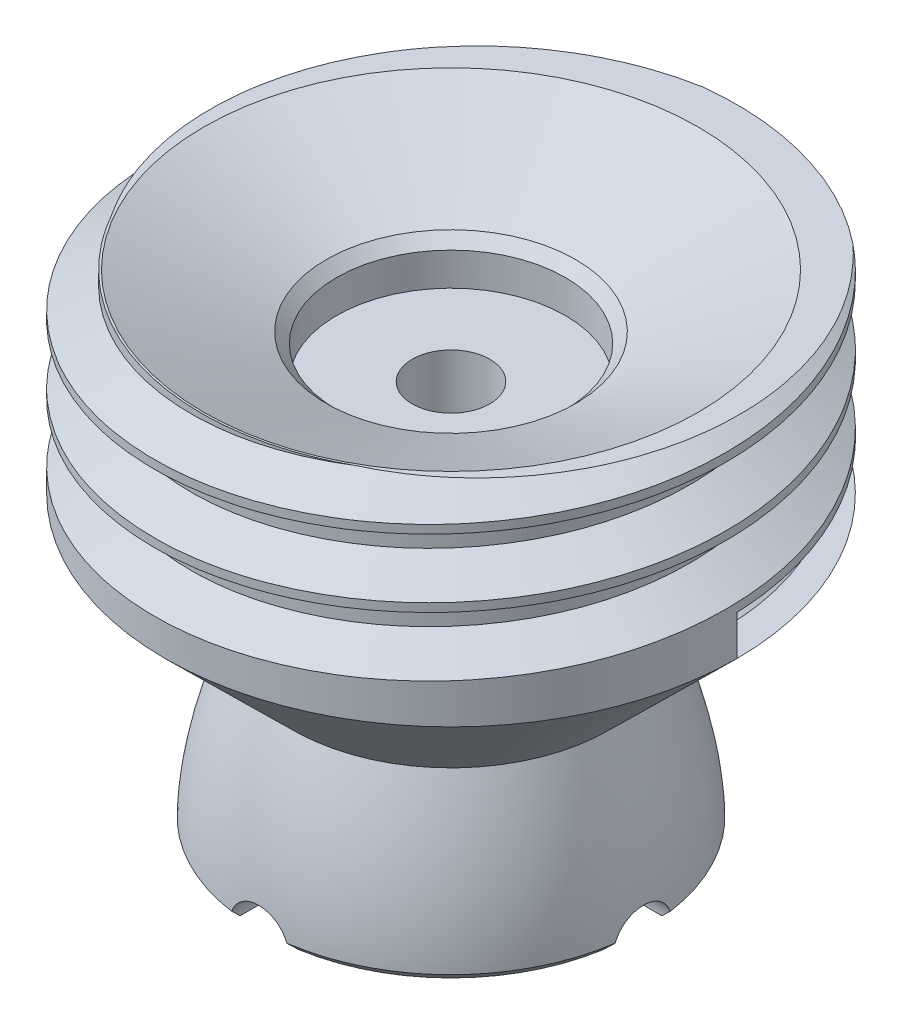
from build123d import *

# Parameters (mm, degrees)
SKETCH1_R           = 14.75
BOSS_EXTRUDE1_DEPTH = 10
CHAMFER1_SIZE       = 0.3
CHAMFER1_SIZE2      = 0.582711802
THREAD1_PITCH       = 3.5
SKETCH6_R           = 1.5
CUT_EXTRUDE1_DEPTH  = 10
CIRPATTERN1_COUNT   = 4
CHAMFER2_SIZE       = 0.5


with BuildPart() as part:
    # Sketch1 → Boss-Extrude1 (new body)
    with BuildSketch(Plane(origin=(0, 0, 0), x_dir=(1, 0, 0), z_dir=(0, 1, 0))):
        with Locations(Location((0, 0, 0), (0, 0, 270))):
            Circle(SKETCH1_R)
    extrude(amount=BOSS_EXTRUDE1_DEPTH)

    # Sketch2 → Cut-Revolve1 (revolve, cut)
    with BuildSketch(Plane.XY, mode=Mode.PRIVATE) as cut_revolve1_sk:
        Polygon((-12.75, 10), (-5.9, 7), (-5.9, 5), (-2, 5), (-2, 0), (0, 0), (0, 10), align=None)
    revolve(cut_revolve1_sk.sketch.rotate(Axis((0, 0, 0), (0, 1, 0)), 270), axis=Axis((0, 0, 0), (0, 1, 0)), mode=Mode.SUBTRACT)

    # Chamfer1
    chamfer1_edges = [part.edges().sort_by_distance(p)[0] for p in [
        (0, 7, 5.9),
    ]]
    chamfer1_side = [part.faces().sort_by_distance(p)[0] for p in [
        (0, 6, 5.9),
    ]]
    chamfer(chamfer1_edges, length=CHAMFER1_SIZE, length2=CHAMFER1_SIZE2, reference=chamfer1_side[0])

    # Sketch3 → Revolve1 (revolve)
    with BuildSketch(Plane.XY, mode=Mode.PRIVATE) as revolve1_sk:
        with BuildLine():
            Line((-2, 0), (-6, 0))
            add(Edge.make_bspline(
                [(-6, 0), (-6, -0.036632834), (-6.001984778, -0.099313082), (-6.019871164, -0.308851925), (-6.076981187, -0.662103545), (-6.213520901, -1.2239813), (-6.485193981, -2.118643776), (-6.976463935, -3.463152951), (-7.967633466, -5.967238423), (-9.06904132, -8.891885812), (-9.736354091, -11.793553851), (-9.957681049, -13.547919401), (-10, -14.471549721), (-10, -14.92820323)],
                knots=[0, 0, 0, 0, 0.03125, 0.0625, 0.125, 0.1875, 0.25, 0.375, 0.5, 0.75, 0.875, 0.9375, 1, 1, 1, 1], degree=3))
            Line((-10, -14.92820323), (-6, -14.92820323))
            add(Edge.make_bspline(
                [(-2, 0), (-2, -3.767042409), (-6, -9.452761511), (-6, -14.92820323)],
                knots=[0, 0, 0, 0, 1, 1, 1, 1], degree=3))
        make_face()
    revolve(revolve1_sk.sketch.rotate(Axis((0, 0, 0), (0, -1, 0)), 90), axis=Axis((0, 0, 0), (0, -1, 0)))

    # Thread1: arcs per turn and ends read off the stored shape
    # Thread1: the profile of Thread Profile1 profile screwed along a right-hand helix through 3.142858 turns, 12 arcs to a turn; built about Z, then put on its axis
    thread1_z = Axis((0, 0, 0), (0, 0, 1))
    thread1_corners = [(14.7503, 0, -0.000173205), (14.7503, 0, 3.062673196), (12.855569438, 0, 1.968749995), (12.855569438, 0, 1.093749995)]
    with BuildLine(mode=Mode.PRIVATE) as thread1_profile:
        Line(thread1_corners[0], thread1_corners[1])
        Line(thread1_corners[1], thread1_corners[2])
        Line(thread1_corners[2], thread1_corners[3])
        Line(thread1_corners[3], thread1_corners[0])
    thread1_cap = Face(thread1_profile.wire())
    thread1_turn_angles = [0, 15, 30, 45, 60, 75, 90, 105, 120, 135, 150, 165, 180, 195, 210, 225, 240, 255, 270, 285, 300, 315, 330, 345, 360]
    thread1_turn_weights = [1, 0.9659258262890683, 1, 0.9659258262890683, 1, 0.9659258262890683, 1, 0.9659258262890683, 1, 0.9659258262890683, 1, 0.9659258262890683, 1, 0.9659258262890683, 1, 0.9659258262890683, 1, 0.9659258262890683, 1, 0.9659258262890683, 1, 0.9659258262890683, 1, 0.9659258262890683, 1]
    thread1_turn_rails = [Edge.make_bspline([Vector(p[0], p[1], 0).rotate(thread1_z, thread1_turn_angles[k]) / thread1_turn_weights[k] + Vector(0, 0, p[2] + THREAD1_PITCH * thread1_turn_angles[k] / 360) for k in range(25)], [0, 0, 0, 1, 1, 2, 2, 3, 3, 4, 4, 5, 5, 6, 6, 7, 7, 8, 8, 9, 9, 10, 10, 11, 11, 12, 12, 12], 2, thread1_turn_weights) for p in thread1_corners]
    thread1_turn_sides = [Face.make_surface_from_curves(thread1_turn_rails[p[0]], thread1_turn_rails[p[1]]) for p in [(0, 1), (1, 2), (2, 3), (3, 0)]]
    thread1_last_angles = [1080, 1095, 1110, 1120.7145, 1131.429]
    thread1_last_weights = [1, 0.9659258262890683, 1, 0.9825657779186314, 1]
    thread1_last_rails = [Edge.make_bspline([Vector(p[0], p[1], 0).rotate(thread1_z, thread1_last_angles[k]) / thread1_last_weights[k] + Vector(0, 0, p[2] + THREAD1_PITCH * thread1_last_angles[k] / 360) for k in range(5)], [0, 0, 0, 1, 1, 2, 2, 2], 2, thread1_last_weights) for p in thread1_corners]
    thread1_last_sides = [Face.make_surface_from_curves(thread1_last_rails[p[0]], thread1_last_rails[p[1]]) for p in [(0, 1), (1, 2), (2, 3), (3, 0)]]
    thread1 = Plane(origin=(0, -1, 0), x_dir=(1, 0, 0), z_dir=(0, 1, 0)) * Solid(Shell([*[p.moved(Location((0, 0, THREAD1_PITCH * i))) for i in range(3) for p in thread1_turn_sides], *thread1_last_sides, thread1_cap, thread1_cap.rotate(thread1_z, 1131.429).moved(Location((0, 0, THREAD1_PITCH * 1131.429 / 360)))]))
    add(thread1, mode=Mode.SUBTRACT)

    # Sketch6 → Cut-Extrude1 (cut)
    with BuildSketch(Plane.XY):
        with Locations((0, -14.92820323)):
            Circle(SKETCH6_R)
    cut_extrude1 = extrude(amount=-CUT_EXTRUDE1_DEPTH, mode=Mode.SUBTRACT)

    # CirPattern1: Cut-Extrude1 ×4 about axis
    cirpattern1_axis = Axis((0, 0, 0), (0, -1, 0))
    for i in range(1, CIRPATTERN1_COUNT):
        add(cut_extrude1.rotate(cirpattern1_axis, i * 360 / CIRPATTERN1_COUNT), mode=Mode.SUBTRACT)

    # Sketch7 → Revolve2 (revolve)
    with BuildSketch(Plane.XY, mode=Mode.PRIVATE) as revolve2_sk:
        with BuildLine():
            Line((-14.75, 0), (-8.156389958, -6.493610301))
            add(Edge.make_bspline(
                [(-6, 0), (-6, -0.036632834), (-6.001984778, -0.099313082), (-6.019871164, -0.308851925), (-6.076981187, -0.662103545), (-6.213520901, -1.2239813), (-6.485193981, -2.118643776), (-6.976463935, -3.463152951), (-7.607741474, -5.058009195), (-8.013229158, -6.110784254), (-8.156389958, -6.493610301)],
                knots=[0, 0, 0, 0, 0.03125, 0.0625, 0.125, 0.1875, 0.25, 0.375, 0.5, 0.56845084, 0.56845084, 0.56845084, 0.56845084], degree=3))
            Line((-6, 0), (-14.75, 0))
        make_face()
    revolve(revolve2_sk.sketch.rotate(Axis((0, 0, 0), (0, 1, 0)), 270), axis=Axis((0, 0, 0), (0, 1, 0)))

    # Chamfer2
    # the kernel refuses this chamfer: 0.5 mm, written as the material it takes off along each edge
    with BuildSketch(Plane(origin=(0, -14.92820323, 0), x_dir=(0.021948617188777685, 0, -0.9997591000853658), z_dir=(-0.9997591000853658, 0, -0.021948617188777685))) as chamfer2_piece_1:
        with BuildLine():
            Line((10 - CHAMFER2_SIZE, 0), (9.992039165, -0.492039165))
            ThreePointArc((9.992039165, -0.492039165), (9.997867711, -0.25300325), (10, 0))
            Line((10, 0), (10 - CHAMFER2_SIZE, 0))
        make_face()
    revolve(axis=Axis((0, -14.92820323, 0), (0, -1, 0)), revolution_arc=87.484671754, mode=Mode.SUBTRACT)
    with BuildSketch(Plane(origin=(0, -14.92820323, 0), x_dir=(-0.9997591000853661, 0, -0.021948617188771065), z_dir=(-0.021948617188771065, 0, 0.9997591000853661))) as chamfer2_piece_2:
        with BuildLine():
            Line((10 - CHAMFER2_SIZE, 0), (9.992039165, -0.492039165))
            ThreePointArc((9.992039165, -0.492039165), (9.997867711, -0.25300325), (10, 0))
            Line((10, 0), (10 - CHAMFER2_SIZE, 0))
        make_face()
    revolve(axis=Axis((0, -14.92820323, 0), (0, -1, 0)), revolution_arc=87.484671754, mode=Mode.SUBTRACT)
    with BuildSketch(Plane(origin=(0, -14.92820323, 0), x_dir=(-0.021948617188806644, 0, 0.9997591000853652), z_dir=(0.9997591000853652, 0, 0.021948617188806644))) as chamfer2_piece_3:
        with BuildLine():
            Line((10 - CHAMFER2_SIZE, 0), (9.992039165, -0.492039165))
            ThreePointArc((9.992039165, -0.492039165), (9.997867711, -0.25300325), (10, 0))
            Line((10, 0), (10 - CHAMFER2_SIZE, 0))
        make_face()
    revolve(axis=Axis((0, -14.92820323, 0), (0, -1, 0)), revolution_arc=87.484671754, mode=Mode.SUBTRACT)
    with BuildSketch(Plane(origin=(0, -14.92820323, 0), x_dir=(0.9997591000853647, 0, 0.021948617188824463), z_dir=(0.021948617188824463, 0, -0.9997591000853647))) as chamfer2_piece_4:
        with BuildLine():
            Line((10 - CHAMFER2_SIZE, 0), (9.992039165, -0.492039165))
            ThreePointArc((9.992039165, -0.492039165), (9.997867711, -0.25300325), (10, 0))
            Line((10, 0), (10 - CHAMFER2_SIZE, 0))
        make_face()
    revolve(axis=Axis((0, -14.92820323, 0), (0, -1, 0)), revolution_arc=87.484671754, mode=Mode.SUBTRACT)


solid = part.part
